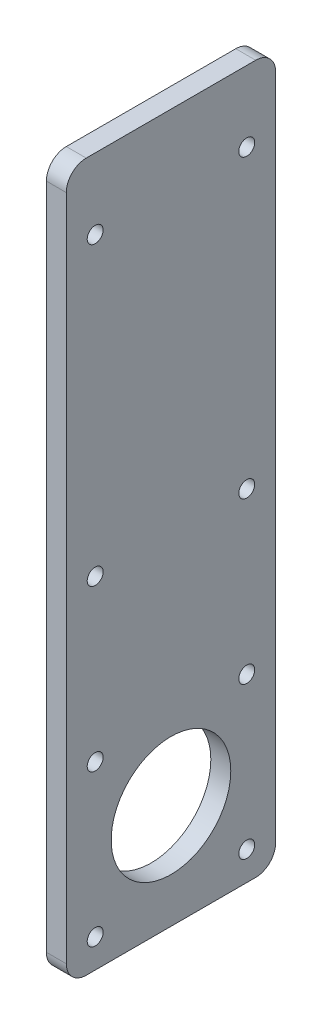
from build123d import *

# Parameters (mm, degrees)
SKETCH1_W           = 42
SKETCH1_H           = 142
SKETCH1_R           = 1.6
SKETCH1_R_2         = 12
BOSS_EXTRUDE1_DEPTH = 4
FILLET1_R           = 4
CUT_EXTRUDE1_REACH  = 124.874
SKETCH2_R           = 1.6


with BuildPart() as part:
    # Sketch1 → Boss-Extrude1 (new body)
    with BuildSketch(Plane(origin=(0, 0, 0), x_dir=(0, 0, -1), z_dir=(1, 0, 0))):
        with Locations((0, 50)):
            Rectangle(SKETCH1_W, SKETCH1_H)
        with Locations((-15.202795796, -15.202795796)):
            Circle(SKETCH1_R, mode=Mode.SUBTRACT)
        Circle(SKETCH1_R_2, mode=Mode.SUBTRACT)
        with Locations((-15.202795796, 15.202795796)):
            Circle(SKETCH1_R, mode=Mode.SUBTRACT)
        with Locations((15.202795796, -15.202795796)):
            Circle(SKETCH1_R, mode=Mode.SUBTRACT)
        with Locations((15.202795796, 15.202795796)):
            Circle(SKETCH1_R, mode=Mode.SUBTRACT)
    extrude(amount=BOSS_EXTRUDE1_DEPTH)

    # Fillet1
    fillet1_edges = [part.edges().sort_by_distance(p)[0] for p in [
        (2, -21, -21),
        (2, -21, 21),
        (2, 121, -21),
        (2, 121, 21),
    ]]
    fillet(fillet1_edges, radius=FILLET1_R)

    # Sketch2 → Cut-Extrude1 (cut, up to next)
    with BuildSketch(Plane(origin=(4, 0, 0), x_dir=(0, 0, -1), z_dir=(1, 0, 0)), mode=Mode.PRIVATE) as cut_extrude1_sk1:
        with Locations((-15.202795796, 47.428904552)):
            Circle(SKETCH2_R)
    cut_extrude1_tool1 = extrude(cut_extrude1_sk1.sketch, amount=-CUT_EXTRUDE1_REACH, mode=Mode.PRIVATE) & part.part
    # Sketch2 → Cut-Extrude1 (cut, up to next)
    with BuildSketch(Plane(origin=(4, 0, 0), x_dir=(0, 0, -1), z_dir=(1, 0, 0)), mode=Mode.PRIVATE) as cut_extrude1_sk2:
        with Locations((15.202795796, 47.428904552)):
            Circle(SKETCH2_R)
    cut_extrude1_tool2 = extrude(cut_extrude1_sk2.sketch, amount=-CUT_EXTRUDE1_REACH, mode=Mode.PRIVATE) & part.part
    # Sketch2 → Cut-Extrude1 (cut, up to next)
    with BuildSketch(Plane(origin=(4, 0, 0), x_dir=(0, 0, -1), z_dir=(1, 0, 0)), mode=Mode.PRIVATE) as cut_extrude1_sk3:
        with Locations((-15.202795796, 106.815089107)):
            Circle(SKETCH2_R)
    cut_extrude1_tool3 = extrude(cut_extrude1_sk3.sketch, amount=-CUT_EXTRUDE1_REACH, mode=Mode.PRIVATE) & part.part
    # Sketch2 → Cut-Extrude1 (cut, up to next)
    with BuildSketch(Plane(origin=(4, 0, 0), x_dir=(0, 0, -1), z_dir=(1, 0, 0)), mode=Mode.PRIVATE) as cut_extrude1_sk4:
        with Locations((15.202795796, 106.815089107)):
            Circle(SKETCH2_R)
    cut_extrude1_tool4 = extrude(cut_extrude1_sk4.sketch, amount=-CUT_EXTRUDE1_REACH, mode=Mode.PRIVATE) & part.part
    add(cut_extrude1_tool1.solids().sort_by_distance((4, 47.428905, 15.202796))[0], mode=Mode.SUBTRACT)
    add(cut_extrude1_tool2.solids().sort_by_distance((4, 47.428905, -15.202796))[0], mode=Mode.SUBTRACT)
    add(cut_extrude1_tool3.solids().sort_by_distance((4, 106.815089, 15.202796))[0], mode=Mode.SUBTRACT)
    add(cut_extrude1_tool4.solids().sort_by_distance((4, 106.815089, -15.202796))[0], mode=Mode.SUBTRACT)


solid = part.part
